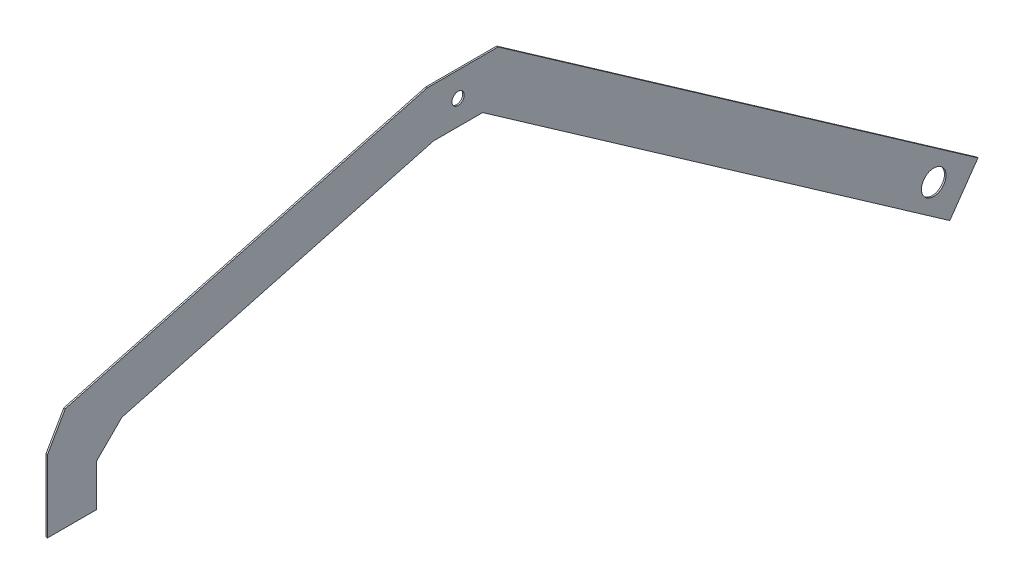
from build123d import *

# Parameters (mm, degrees)
SKETCH1_R           = 6.35
SKETCH1_R_2         = 12.7
BOSS_EXTRUDE1_DEPTH = 1.5875
CHAMFER1_SIZE       = 19.05
CHAMFER1_SIZE2      = 26.940768363
CHAMFER2_SIZE       = 19.05
CHAMFER2_SIZE2      = 26.940768363


with BuildPart() as part:
    # Sketch1 → Boss-Extrude1 (new body)
    with BuildSketch(Plane(origin=(0, 0, 0), x_dir=(0, 0, -1), z_dir=(1, 0, 0))):
        Polygon((-32.087946877, 25.4), (41.417178475, 25.4), (537.742683793, -322.13086023), (508.605000827, -363.74378408), (25.4, -25.4), (-25.4, -25.4), (-373.840202681, -118.764270919), (-373.840202681, -181.38405993), (-424.640202681, -181.38405993), (-424.640202681, -79.78405993), align=None)
        Circle(SKETCH1_R, mode=Mode.SUBTRACT)
        with Locations((491.964149423, -321.08405993)):
            Circle(SKETCH1_R_2, mode=Mode.SUBTRACT)
    extrude(amount=BOSS_EXTRUDE1_DEPTH)

    # Chamfer1
    chamfer1_edges = [part.edges().sort_by_distance(p)[0] for p in [
        (0.79375, -118.764270919, 373.840202681),
    ]]
    chamfer1_side = [part.faces().sort_by_distance(p)[0] for p in [
        (0.79375, -150.074165424, 373.840202681),
    ]]
    chamfer(chamfer1_edges, length=CHAMFER1_SIZE, length2=CHAMFER1_SIZE2, reference=chamfer1_side[0])

    # Chamfer2
    chamfer2_edges = [part.edges().sort_by_distance(p)[0] for p in [
        (0.79375, -79.78405993, 424.640202681),
    ]]
    chamfer2_side = [part.faces().sort_by_distance(p)[0] for p in [
        (0.79375, -27.192029965, 228.364074779),
    ]]
    chamfer(chamfer2_edges, length=CHAMFER2_SIZE, length2=CHAMFER2_SIZE2, reference=chamfer2_side[0])


solid = part.part
